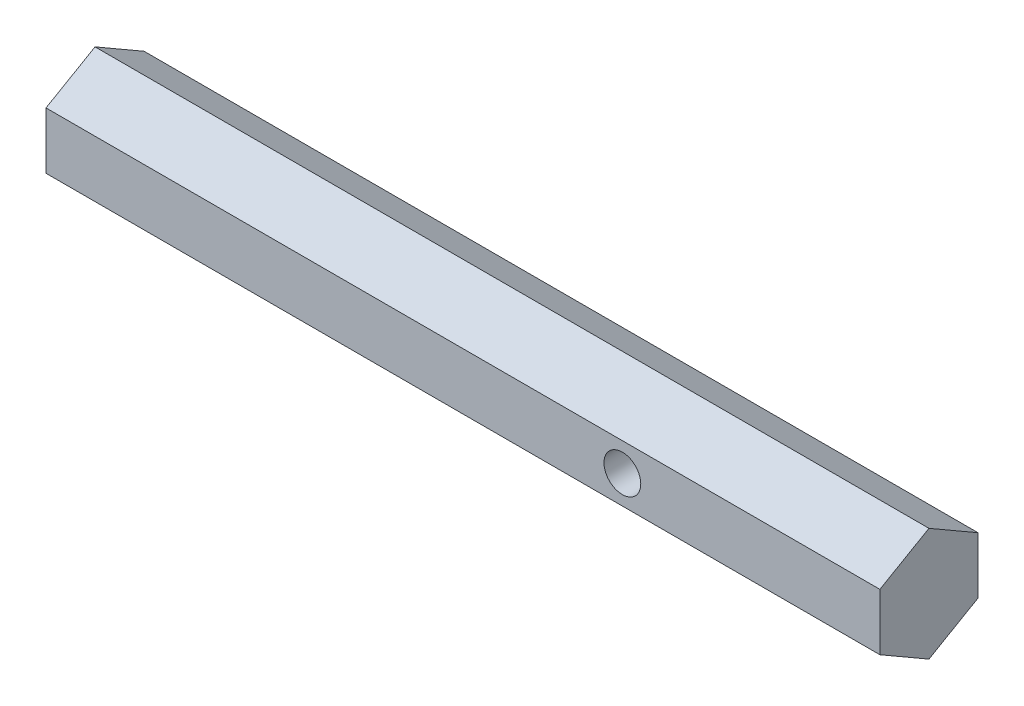
from build123d import *

# Parameters (mm, degrees)
BOSS_EXTRUDE1_DEPTH = 107.95
SKETCH2_R           = 2.38125
CUT_EXTRUDE1_DEPTH  = 109.941524835


with BuildPart() as part:
    # Sketch1 → Boss-Extrude1 (new body)
    with BuildSketch(Plane(origin=(0, 0, 0), x_dir=(0, 0, -1), z_dir=(1, 0, 0))):
        Polygon((6.35, -3.666174209), (6.35, 3.666174209), (0, 7.332348419), (-6.35, 3.666174209), (-6.35, -3.666174209), (0, -7.332348419), align=None)
    extrude(amount=BOSS_EXTRUDE1_DEPTH)

    # Sketch2 → Cut-Extrude1 (cut, through all)
    with BuildSketch(Plane.XY.offset(6.35)):
        with Locations((74.6125, 0)):
            Circle(SKETCH2_R)
    extrude(amount=-CUT_EXTRUDE1_DEPTH, mode=Mode.SUBTRACT)


solid = part.part
